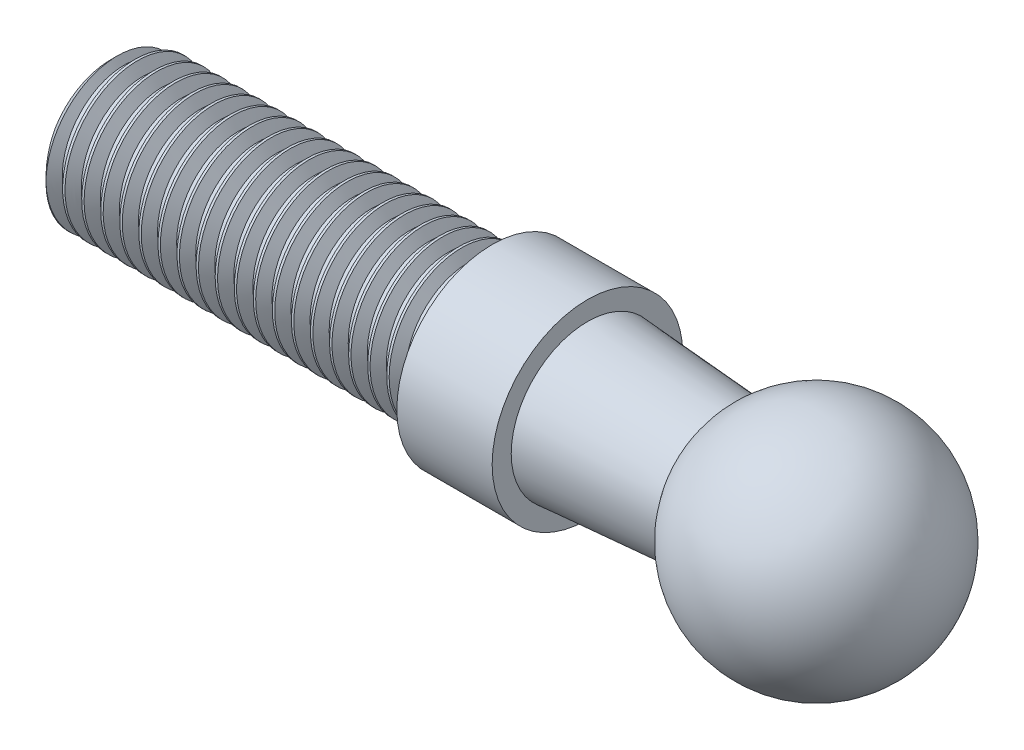
from build123d import *

# Parameters (mm, degrees)
THREAD1_PITCH = 1


with BuildPart() as part:
    # Sketch1 → Revolve1 (revolve)
    with BuildSketch(Plane.XY, mode=Mode.PRIVATE) as revolve1_sk:
        with BuildLine():
            Line((0, 0), (0, 3.9))
            Line((0, 3.9), (20, 3.9))
            Line((20, 3.9), (20, 5))
            Line((20, 5), (25, 5))
            Line((25, 5), (25, 4))
            Line((25, 4), (32.126602828, 3.5))
            ThreePointArc((32.126602828, 3.5), (38.838425545, 5.711408891), (43, 0))
            Line((43, 0), (0, 0))
        make_face()
    revolve(revolve1_sk.sketch.rotate(Axis((0, 0, 0), (1, 0, 0)), 90), axis=Axis((0, 0, 0), (1, 0, 0)))

    # Thread1: arcs per turn and ends read off the stored shape
    # Thread1: the profile of Thread Profile1 profile screwed along a right-hand helix through 23 turns, 8 arcs to a turn; built about Z, then put on its axis
    thread1_z = Axis((0, 0, 0), (0, 0, 1))
    thread1_corners = [(3.9003, 0, -0.000173205), (3.9003, 0, 0.875173202), (3.358734125, 0, 0.562499999), (3.358734125, 0, 0.312499999)]
    with BuildLine(mode=Mode.PRIVATE) as thread1_profile:
        Line(thread1_corners[0], thread1_corners[1])
        Line(thread1_corners[1], thread1_corners[2])
        Line(thread1_corners[2], thread1_corners[3])
        Line(thread1_corners[3], thread1_corners[0])
    thread1_cap = Face(thread1_profile.wire())
    thread1_turn_angles = [0, 22.5, 45, 67.5, 90, 112.5, 135, 157.5, 180, 202.5, 225, 247.5, 270, 292.5, 315, 337.5, 360]
    thread1_turn_weights = [1, 0.9238795325112867, 1, 0.9238795325112867, 1, 0.9238795325112867, 1, 0.9238795325112867, 1, 0.9238795325112867, 1, 0.9238795325112867, 1, 0.9238795325112867, 1, 0.9238795325112867, 1]
    thread1_turn_rails = [Edge.make_bspline([Vector(p[0], p[1], 0).rotate(thread1_z, thread1_turn_angles[k]) / thread1_turn_weights[k] + Vector(0, 0, p[2] + THREAD1_PITCH * thread1_turn_angles[k] / 360) for k in range(17)], [0, 0, 0, 1, 1, 2, 2, 3, 3, 4, 4, 5, 5, 6, 6, 7, 7, 8, 8, 8], 2, thread1_turn_weights) for p in thread1_corners]
    thread1_turn_sides = [Face.make_surface_from_curves(thread1_turn_rails[p[0]], thread1_turn_rails[p[1]]) for p in [(0, 1), (1, 2), (2, 3), (3, 0)]]
    thread1 = Plane(origin=(-2, 0, 0), x_dir=(0, 0, -1), z_dir=(1, 0, 0)) * Solid(Shell([*[p.moved(Location((0, 0, THREAD1_PITCH * i))) for i in range(23) for p in thread1_turn_sides], thread1_cap, thread1_cap.rotate(thread1_z, 8280).moved(Location((0, 0, THREAD1_PITCH * 8280 / 360)))]))
    add(thread1, mode=Mode.SUBTRACT)

    # Chamfer1: read off the stored shape, not the designer's step
    # Chamfer1 outline → Chamfer1 (revolve, cut)
    with BuildSketch(Plane.YX):
        Polygon((3.9, 0.5), (3.4, 0), (3.9, 0), align=None)
    revolve(axis=Axis((0, 0, 0), (1, 0, 0)), mode=Mode.SUBTRACT)


solid = part.part
